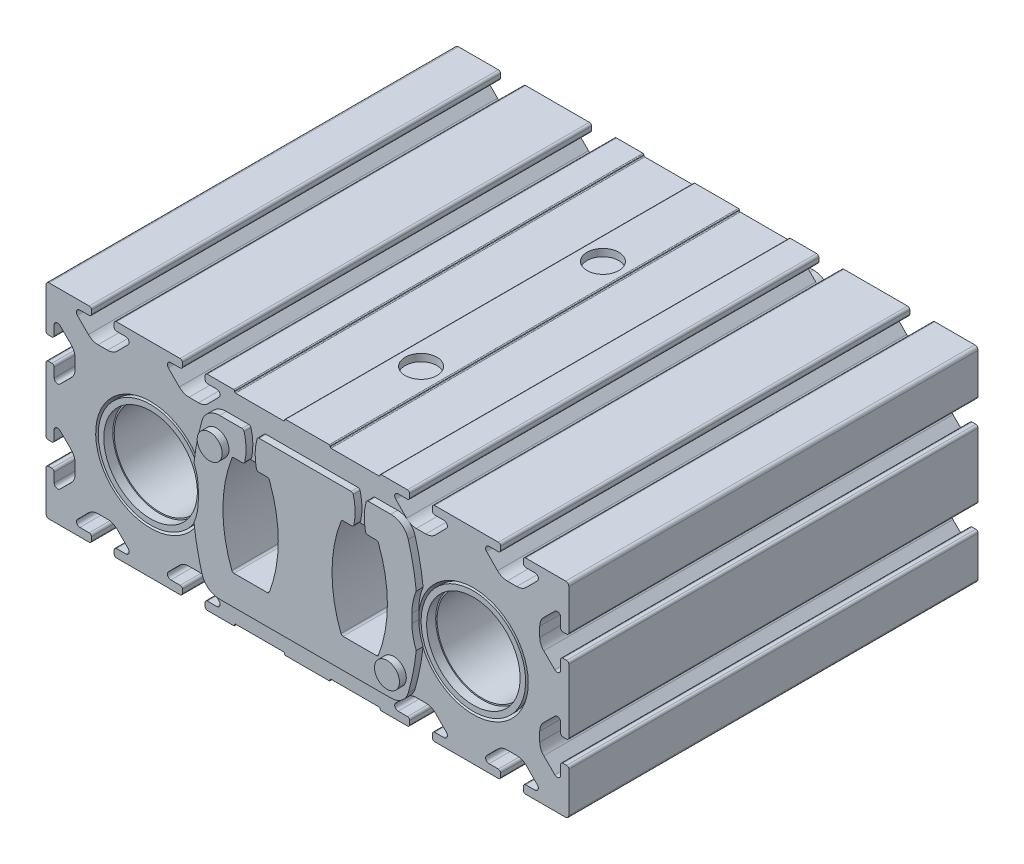
from build123d import *

# Parameters (mm, degrees)
BOSS_EXTRUDE1_DEPTH = 90
BOSS_EXTRUDE2_START = 1.5
SKETCH8_R           = 1.5
BOSS_EXTRUDE2_DEPTH = 1.5
SKETCH9_R           = 1.5
BOSS_EXTRUDE3_DEPTH = 1.5
SKETCH14_W          = 3.5
SKETCH14_H          = 1.6
SKETCH15_W          = 3.5
SKETCH15_H          = 1.6
SKETCH16_W          = 1.6
SKETCH16_H          = 3.5
SKETCH17_W          = 1.6
SKETCH17_H          = 3.5


with BuildPart() as part:
    # Sketch1 → Boss-Extrude1 (new body)
    with BuildSketch(Plane.XY):
        with BuildLine():
            Line((-56.8, -22.5), (-48, -22.5))
            ThreePointArc((-48, -22.5), (-47.646446609, -22.353553391), (-47.5, -22))
            Line((-47.5, -22), (-47.5, -21.2))
            ThreePointArc((-47.5, -21.2), (-47.646446609, -20.846446609), (-48, -20.7))
            Line((-48, -20.7), (-50.05, -20.7))
            ThreePointArc((-50.05, -20.7), (-50.742051615, -20.239075357), (-50.583480181, -19.422838832))
            Line((-50.583480181, -19.422838832), (-48.180797325, -16.991355328))
            ThreePointArc((-48.180797325, -16.991355328), (-47.203178031, -16.33179354), (-46.046876603, -16.1))
            Line((-46.046876603, -16.1), (-43.953123397, -16.1))
            ThreePointArc((-43.953123397, -16.1), (-42.796821969, -16.33179354), (-41.819202675, -16.991355328))
            Line((-41.819202675, -16.991355328), (-39.416519819, -19.422838832))
            ThreePointArc((-39.416519819, -19.422838832), (-39.257948385, -20.239075357), (-39.95, -20.7))
            Line((-39.95, -20.7), (-42, -20.7))
            ThreePointArc((-42, -20.7), (-42.353553391, -20.846446609), (-42.5, -21.2))
            Line((-42.5, -21.2), (-42.5, -22))
            ThreePointArc((-42.5, -22), (-42.353553391, -22.353553391), (-42, -22.5))
            Line((-42, -22.5), (-28, -22.5))
            ThreePointArc((-28, -22.5), (-27.646446609, -22.353553391), (-27.5, -22))
            Line((-27.5, -22), (-27.5, -21.2))
            ThreePointArc((-27.5, -21.2), (-27.646446609, -20.846446609), (-28, -20.7))
            Line((-28, -20.7), (-30.05, -20.7))
            ThreePointArc((-30.05, -20.7), (-30.742051615, -20.239075357), (-30.583480181, -19.422838832))
            Line((-30.583480181, -19.422838832), (-28.180797325, -16.991355328))
            ThreePointArc((-28.180797325, -16.991355328), (-27.203178031, -16.33179354), (-26.046876603, -16.1))
            Line((-26.046876603, -16.1), (-23.953123397, -16.1))
            ThreePointArc((-23.953123397, -16.1), (-22.796821969, -16.33179354), (-21.819202675, -16.991355328))
            Line((-21.819202675, -16.991355328), (-19.416519819, -19.422838832))
            ThreePointArc((-19.416519819, -19.422838832), (-19.257948385, -20.239075357), (-19.95, -20.7))
            Line((-19.95, -20.7), (-22, -20.7))
            ThreePointArc((-22, -20.7), (-22.353553391, -20.846446609), (-22.5, -21.2))
            Line((-22.5, -21.2), (-22.5, -22))
            ThreePointArc((-22.5, -22), (-22.353553391, -22.353553391), (-22, -22.5))
            Line((-22, -22.5), (-16.2, -22.5))
            ThreePointArc((-16.2, -22.5), (-16.058578644, -22.441421356), (-16, -22.3))
            Line((-16, -22.3), (-16, -22.2))
            ThreePointArc((-16, -22.2), (-15.941421356, -22.058578644), (-15.8, -22))
            Line((-15.8, -22), (-5.2, -22))
            ThreePointArc((-5.2, -22), (-5.058578644, -22.058578644), (-5, -22.2))
            Line((-5, -22.2), (-5, -22.3))
            ThreePointArc((-5, -22.3), (-4.941421356, -22.441421356), (-4.8, -22.5))
            Line((-4.8, -22.5), (4.8, -22.5))
            ThreePointArc((4.8, -22.5), (4.941421356, -22.441421356), (5, -22.3))
            Line((5, -22.3), (5, -22.2))
            ThreePointArc((5, -22.2), (5.058578644, -22.058578644), (5.2, -22))
            Line((5.2, -22), (15.8, -22))
            ThreePointArc((15.8, -22), (15.941421356, -22.058578644), (16, -22.2))
            Line((16, -22.2), (16, -22.3))
            ThreePointArc((16, -22.3), (16.058578644, -22.441421356), (16.2, -22.5))
            Line((16.2, -22.5), (22, -22.5))
            ThreePointArc((22, -22.5), (22.353553391, -22.353553391), (22.5, -22))
            Line((22.5, -22), (22.5, -21.2))
            ThreePointArc((22.5, -21.2), (22.353553391, -20.846446609), (22, -20.7))
            Line((22, -20.7), (19.95, -20.7))
            ThreePointArc((19.95, -20.7), (19.257948385, -20.239075357), (19.416519819, -19.422838832))
            Line((19.416519819, -19.422838832), (21.819202675, -16.991355328))
            ThreePointArc((21.819202675, -16.991355328), (22.796821969, -16.33179354), (23.953123397, -16.1))
            Line((23.953123397, -16.1), (26.046876603, -16.1))
            ThreePointArc((26.046876603, -16.1), (27.203178031, -16.33179354), (28.180797325, -16.991355328))
            Line((28.180797325, -16.991355328), (30.583480181, -19.422838832))
            ThreePointArc((30.583480181, -19.422838832), (30.742051615, -20.239075357), (30.05, -20.7))
            Line((30.05, -20.7), (28, -20.7))
            ThreePointArc((28, -20.7), (27.646446609, -20.846446609), (27.5, -21.2))
            Line((27.5, -21.2), (27.5, -22))
            ThreePointArc((27.5, -22), (27.646446609, -22.353553391), (28, -22.5))
            Line((28, -22.5), (42, -22.5))
            ThreePointArc((42, -22.5), (42.353553391, -22.353553391), (42.5, -22))
            Line((42.5, -22), (42.5, -21.2))
            ThreePointArc((42.5, -21.2), (42.353553391, -20.846446609), (42, -20.7))
            Line((42, -20.7), (39.95, -20.7))
            ThreePointArc((39.95, -20.7), (39.257948385, -20.239075357), (39.416519819, -19.422838832))
            Line((39.416519819, -19.422838832), (41.819202675, -16.991355328))
            ThreePointArc((41.819202675, -16.991355328), (42.796821969, -16.33179354), (43.953123397, -16.1))
            Line((43.953123397, -16.1), (46.046876603, -16.1))
            ThreePointArc((46.046876603, -16.1), (47.203178031, -16.33179354), (48.180797325, -16.991355328))
            Line((48.180797325, -16.991355328), (50.583480181, -19.422838832))
            ThreePointArc((50.583480181, -19.422838832), (50.742051615, -20.239075357), (50.05, -20.7))
            Line((50.05, -20.7), (48, -20.7))
            ThreePointArc((48, -20.7), (47.646446609, -20.846446609), (47.5, -21.2))
            Line((47.5, -21.2), (47.5, -22))
            ThreePointArc((47.5, -22), (47.646446609, -22.353553391), (48, -22.5))
            Line((48, -22.5), (56.8, -22.5))
            ThreePointArc((56.8, -22.5), (57.294974747, -22.294974747), (57.5, -21.8))
            Line((57.5, -21.8), (57.5, -13))
            ThreePointArc((57.5, -13), (57.353553391, -12.646446609), (57, -12.5))
            Line((57, -12.5), (56.2, -12.5))
            ThreePointArc((56.2, -12.5), (55.846446609, -12.646446609), (55.7, -13))
            Line((55.7, -13), (55.7, -15.05))
            ThreePointArc((55.7, -15.05), (55.239075357, -15.742051615), (54.422838832, -15.583480181))
            Line((54.422838832, -15.583480181), (51.991355328, -13.180797325))
            ThreePointArc((51.991355328, -13.180797325), (51.33179354, -12.203178031), (51.1, -11.046876603))
            Line((51.1, -11.046876603), (51.1, -8.953123397))
            ThreePointArc((51.1, -8.953123397), (51.33179354, -7.796821969), (51.991355328, -6.819202675))
            Line((51.991355328, -6.819202675), (54.422838832, -4.416519819))
            ThreePointArc((54.422838832, -4.416519819), (55.239075357, -4.257948385), (55.7, -4.95))
            Line((55.7, -4.95), (55.7, -7))
            ThreePointArc((55.7, -7), (55.846446609, -7.353553391), (56.2, -7.5))
            Line((56.2, -7.5), (57, -7.5))
            ThreePointArc((57, -7.5), (57.353553391, -7.353553391), (57.5, -7))
            Line((57.5, -7), (57.5, 7))
            ThreePointArc((57.5, 7), (57.353553391, 7.353553391), (57, 7.5))
            Line((57, 7.5), (56.2, 7.5))
            ThreePointArc((56.2, 7.5), (55.846446609, 7.353553391), (55.7, 7))
            Line((55.7, 7), (55.7, 4.95))
            ThreePointArc((55.7, 4.95), (55.239075357, 4.257948385), (54.422838832, 4.416519819))
            Line((54.422838832, 4.416519819), (51.991355328, 6.819202675))
            ThreePointArc((51.991355328, 6.819202675), (51.33179354, 7.796821969), (51.1, 8.953123397))
            Line((51.1, 8.953123397), (51.1, 11.046876603))
            ThreePointArc((51.1, 11.046876603), (51.33179354, 12.203178031), (51.991355328, 13.180797325))
            Line((51.991355328, 13.180797325), (54.422838832, 15.583480181))
            ThreePointArc((54.422838832, 15.583480181), (55.239075357, 15.742051615), (55.7, 15.05))
            Line((55.7, 15.05), (55.7, 13))
            ThreePointArc((55.7, 13), (55.846446609, 12.646446609), (56.2, 12.5))
            Line((56.2, 12.5), (57, 12.5))
            ThreePointArc((57, 12.5), (57.353553391, 12.646446609), (57.5, 13))
            Line((57.5, 13), (57.5, 21.8))
            ThreePointArc((57.5, 21.8), (57.294974747, 22.294974747), (56.8, 22.5))
            Line((56.8, 22.5), (48, 22.5))
            ThreePointArc((48, 22.5), (47.646446609, 22.353553391), (47.5, 22))
            Line((47.5, 22), (47.5, 21.2))
            ThreePointArc((47.5, 21.2), (47.646446609, 20.846446609), (48, 20.7))
            Line((48, 20.7), (50.05, 20.7))
            ThreePointArc((50.05, 20.7), (50.742051615, 20.239075357), (50.583480181, 19.422838832))
            Line((50.583480181, 19.422838832), (48.180797325, 16.991355328))
            ThreePointArc((48.180797325, 16.991355328), (47.203178031, 16.33179354), (46.046876603, 16.1))
            Line((46.046876603, 16.1), (43.953123397, 16.1))
            ThreePointArc((43.953123397, 16.1), (42.796821969, 16.33179354), (41.819202675, 16.991355328))
            Line((41.819202675, 16.991355328), (39.416519819, 19.422838832))
            ThreePointArc((39.416519819, 19.422838832), (39.257948385, 20.239075357), (39.95, 20.7))
            Line((39.95, 20.7), (42, 20.7))
            ThreePointArc((42, 20.7), (42.353553391, 20.846446609), (42.5, 21.2))
            Line((42.5, 21.2), (42.5, 22))
            ThreePointArc((42.5, 22), (42.353553391, 22.353553391), (42, 22.5))
            Line((42, 22.5), (28, 22.5))
            ThreePointArc((28, 22.5), (27.646446609, 22.353553391), (27.5, 22))
            Line((27.5, 22), (27.5, 21.2))
            ThreePointArc((27.5, 21.2), (27.646446609, 20.846446609), (28, 20.7))
            Line((28, 20.7), (30.05, 20.7))
            ThreePointArc((30.05, 20.7), (30.742051615, 20.239075357), (30.583480181, 19.422838832))
            Line((30.583480181, 19.422838832), (28.180797325, 16.991355328))
            ThreePointArc((28.180797325, 16.991355328), (27.203178031, 16.33179354), (26.046876603, 16.1))
            Line((26.046876603, 16.1), (23.953123397, 16.1))
            ThreePointArc((23.953123397, 16.1), (22.796821969, 16.33179354), (21.819202675, 16.991355328))
            Line((21.819202675, 16.991355328), (19.416519819, 19.422838832))
            ThreePointArc((19.416519819, 19.422838832), (19.257948385, 20.239075357), (19.95, 20.7))
            Line((19.95, 20.7), (22, 20.7))
            ThreePointArc((22, 20.7), (22.353553391, 20.846446609), (22.5, 21.2))
            Line((22.5, 21.2), (22.5, 22))
            ThreePointArc((22.5, 22), (22.353553391, 22.353553391), (22, 22.5))
            Line((22, 22.5), (16.2, 22.5))
            ThreePointArc((16.2, 22.5), (16.058578644, 22.441421356), (16, 22.3))
            Line((16, 22.3), (16, 22.2))
            ThreePointArc((16, 22.2), (15.941421356, 22.058578644), (15.8, 22))
            Line((15.8, 22), (5.2, 22))
            ThreePointArc((5.2, 22), (5.058578644, 22.058578644), (5, 22.2))
            Line((5, 22.2), (5, 22.3))
            ThreePointArc((5, 22.3), (4.941421356, 22.441421356), (4.8, 22.5))
            Line((4.8, 22.5), (-4.8, 22.5))
            ThreePointArc((-4.8, 22.5), (-4.941421356, 22.441421356), (-5, 22.3))
            Line((-5, 22.3), (-5, 22.2))
            ThreePointArc((-5, 22.2), (-5.058578644, 22.058578644), (-5.2, 22))
            Line((-5.2, 22), (-15.8, 22))
            ThreePointArc((-15.8, 22), (-15.941421356, 22.058578644), (-16, 22.2))
            Line((-16, 22.2), (-16, 22.3))
            ThreePointArc((-16, 22.3), (-16.058578644, 22.441421356), (-16.2, 22.5))
            Line((-16.2, 22.5), (-22, 22.5))
            ThreePointArc((-22, 22.5), (-22.353553391, 22.353553391), (-22.5, 22))
            Line((-22.5, 22), (-22.5, 21.2))
            ThreePointArc((-22.5, 21.2), (-22.353553391, 20.846446609), (-22, 20.7))
            Line((-22, 20.7), (-19.95, 20.7))
            ThreePointArc((-19.95, 20.7), (-19.257948385, 20.239075357), (-19.416519819, 19.422838832))
            Line((-19.416519819, 19.422838832), (-21.819202675, 16.991355328))
            ThreePointArc((-21.819202675, 16.991355328), (-22.796821969, 16.33179354), (-23.953123397, 16.1))
            Line((-23.953123397, 16.1), (-26.046876603, 16.1))
            ThreePointArc((-26.046876603, 16.1), (-27.203178031, 16.33179354), (-28.180797325, 16.991355328))
            Line((-28.180797325, 16.991355328), (-30.583480181, 19.422838832))
            ThreePointArc((-30.583480181, 19.422838832), (-30.742051615, 20.239075357), (-30.05, 20.7))
            Line((-30.05, 20.7), (-28, 20.7))
            ThreePointArc((-28, 20.7), (-27.646446609, 20.846446609), (-27.5, 21.2))
            Line((-27.5, 21.2), (-27.5, 22))
            ThreePointArc((-27.5, 22), (-27.646446609, 22.353553391), (-28, 22.5))
            Line((-28, 22.5), (-42, 22.5))
            ThreePointArc((-42, 22.5), (-42.353553391, 22.353553391), (-42.5, 22))
            Line((-42.5, 22), (-42.5, 21.2))
            ThreePointArc((-42.5, 21.2), (-42.353553391, 20.846446609), (-42, 20.7))
            Line((-42, 20.7), (-39.95, 20.7))
            ThreePointArc((-39.95, 20.7), (-39.257948385, 20.239075357), (-39.416519819, 19.422838832))
            Line((-39.416519819, 19.422838832), (-41.819202675, 16.991355328))
            ThreePointArc((-41.819202675, 16.991355328), (-42.796821969, 16.33179354), (-43.953123397, 16.1))
            Line((-43.953123397, 16.1), (-46.046876603, 16.1))
            ThreePointArc((-46.046876603, 16.1), (-47.203178031, 16.33179354), (-48.180797325, 16.991355328))
            Line((-48.180797325, 16.991355328), (-50.583480181, 19.422838832))
            ThreePointArc((-50.583480181, 19.422838832), (-50.742051615, 20.239075357), (-50.05, 20.7))
            Line((-50.05, 20.7), (-48, 20.7))
            ThreePointArc((-48, 20.7), (-47.646446609, 20.846446609), (-47.5, 21.2))
            Line((-47.5, 21.2), (-47.5, 22))
            ThreePointArc((-47.5, 22), (-47.646446609, 22.353553391), (-48, 22.5))
            Line((-48, 22.5), (-56.8, 22.5))
            ThreePointArc((-56.8, 22.5), (-57.294974747, 22.294974747), (-57.5, 21.8))
            Line((-57.5, 21.8), (-57.5, 13))
            ThreePointArc((-57.5, 13), (-57.353553391, 12.646446609), (-57, 12.5))
            Line((-57, 12.5), (-56.2, 12.5))
            ThreePointArc((-56.2, 12.5), (-55.846446609, 12.646446609), (-55.7, 13))
            Line((-55.7, 13), (-55.7, 15.05))
            ThreePointArc((-55.7, 15.05), (-55.239075357, 15.742051615), (-54.422838832, 15.583480181))
            Line((-54.422838832, 15.583480181), (-51.991355328, 13.180797325))
            ThreePointArc((-51.991355328, 13.180797325), (-51.33179354, 12.203178031), (-51.1, 11.046876603))
            Line((-51.1, 11.046876603), (-51.1, 8.953123397))
            ThreePointArc((-51.1, 8.953123397), (-51.33179354, 7.796821969), (-51.991355328, 6.819202675))
            Line((-51.991355328, 6.819202675), (-54.422838832, 4.416519819))
            ThreePointArc((-54.422838832, 4.416519819), (-55.239075357, 4.257948385), (-55.7, 4.95))
            Line((-55.7, 4.95), (-55.7, 7))
            ThreePointArc((-55.7, 7), (-55.846446609, 7.353553391), (-56.2, 7.5))
            Line((-56.2, 7.5), (-57, 7.5))
            ThreePointArc((-57, 7.5), (-57.353553391, 7.353553391), (-57.5, 7))
            Line((-57.5, 7), (-57.5, -7))
            ThreePointArc((-57.5, -7), (-57.353553391, -7.353553391), (-57, -7.5))
            Line((-57, -7.5), (-56.2, -7.5))
            ThreePointArc((-56.2, -7.5), (-55.846446609, -7.353553391), (-55.7, -7))
            Line((-55.7, -7), (-55.7, -4.95))
            ThreePointArc((-55.7, -4.95), (-55.239075357, -4.257948385), (-54.422838832, -4.416519819))
            Line((-54.422838832, -4.416519819), (-51.991355328, -6.819202675))
            ThreePointArc((-51.991355328, -6.819202675), (-51.33179354, -7.796821969), (-51.1, -8.953123397))
            Line((-51.1, -8.953123397), (-51.1, -11.046876603))
            ThreePointArc((-51.1, -11.046876603), (-51.33179354, -12.203178031), (-51.991355328, -13.180797325))
            Line((-51.991355328, -13.180797325), (-54.422838832, -15.583480181))
            ThreePointArc((-54.422838832, -15.583480181), (-55.239075357, -15.742051615), (-55.7, -15.05))
            Line((-55.7, -15.05), (-55.7, -13))
            ThreePointArc((-55.7, -13), (-55.846446609, -12.646446609), (-56.2, -12.5))
            Line((-56.2, -12.5), (-57, -12.5))
            ThreePointArc((-57, -12.5), (-57.353553391, -12.646446609), (-57.5, -13))
            Line((-57.5, -13), (-57.5, -21.8))
            ThreePointArc((-57.5, -21.8), (-57.294974747, -22.294974747), (-56.8, -22.5))
        make_face()
        with BuildLine():
            Line((9.34247397, -11), (16.65752603, -11))
            ThreePointArc((16.65752603, -11), (16.941266184, -10.911693485), (17.12478192, -10.677966102))
            ThreePointArc((17.12478192, -10.677966102), (19.089428526, 0), (17.12478192, 10.677966102))
            ThreePointArc((17.12478192, 10.677966102), (16.941266184, 10.911693485), (16.65752603, 11))
            Line((16.65752603, 11), (9.34247397, 11))
            ThreePointArc((9.34247397, 11), (9.058733816, 10.911693485), (8.87521808, 10.677966102))
            ThreePointArc((8.87521808, 10.677966102), (6.910571474, 0), (8.87521808, -10.677966102))
            ThreePointArc((8.87521808, -10.677966102), (9.058733816, -10.911693485), (9.34247397, -11))
        make_face(mode=Mode.SUBTRACT)
        with BuildLine():
            Line((-14.65752603, -11), (-7.34247397, -11))
            ThreePointArc((-7.34247397, -11), (-7.058733816, -10.911693485), (-6.87521808, -10.677966102))
            ThreePointArc((-6.87521808, -10.677966102), (-4.910571474, 0), (-6.87521808, 10.677966102))
            ThreePointArc((-6.87521808, 10.677966102), (-7.058733816, 10.911693485), (-7.34247397, 11))
            Line((-7.34247397, 11), (-14.65752603, 11))
            ThreePointArc((-14.65752603, 11), (-14.941266184, 10.911693485), (-15.12478192, 10.677966102))
            ThreePointArc((-15.12478192, 10.677966102), (-17.089428526, 0), (-15.12478192, -10.677966102))
            ThreePointArc((-15.12478192, -10.677966102), (-14.941266184, -10.911693485), (-14.65752603, -11))
        make_face(mode=Mode.SUBTRACT)
    extrude(amount=-BOSS_EXTRUDE1_DEPTH)

    # Sketch2 → Cut-Revolve1 (revolve, cut)
    with BuildSketch(Plane(origin=(0, -1, 0), x_dir=(1, 0, 0), z_dir=(0, 1, 0))):
        Polygon((-34.5, 90), (-22.422649731, 90), (-23, 89), (-23, 1), (-22.422649731, 0), (-34.5, 0), align=None)
    revolve(axis=Axis((-34.5, -1, 0), (0, 0, -1)), mode=Mode.SUBTRACT)

    # Sketch3 → Cut-Revolve2 (revolve, cut)
    with BuildSketch(Plane(origin=(0, -1, 0), x_dir=(1, 0, 0), z_dir=(0, 1, 0))):
        Polygon((36.5, 90), (48.577350269, 90), (48, 89), (48, 1), (48.577350269, 0), (36.5, 0), align=None)
    revolve(axis=Axis((36.5, -1, 0), (0, 0, -1)), mode=Mode.SUBTRACT)

    # Sketch4 → Revolve1 (revolve)
    with BuildSketch(Plane(origin=(0, -1, 0), x_dir=(1, 0, 0), z_dir=(0, 1, 0))):
        Polygon((-24.5, 2), (-24.21, 2), (-24.21, 0), (-23, 0), (-23, 24.2), (-23.461880215, 25), (-24.5, 25), align=None)
    revolve(axis=Axis((-34.5, -1, 0), (0, 0, -1)))

    # Sketch5 → Revolve2 (revolve)
    with BuildSketch(Plane(origin=(0, -1, 0), x_dir=(1, 0, 0), z_dir=(0, 1, 0))):
        Polygon((46.5, 2), (46.79, 2), (46.79, 0), (48, 0), (48, 24.2), (47.538119785, 25), (46.5, 25), align=None)
    revolve(axis=Axis((36.5, -1, 0), (0, 0, -1)))

    # Sketch6 → Revolve3 (revolve)
    with BuildSketch(Plane(origin=(0, -1, 0), x_dir=(1, 0, 0), z_dir=(0, 1, 0))):
        Polygon((46.5, 88), (46.5, 65), (47.538119785, 65), (48, 65.8), (48, 90), (46.79, 90), (46.79, 88), align=None)
    revolve(axis=Axis((36.5, -1, -65), (0, 0, -1)))

    # Sketch7 → Revolve4 (revolve)
    with BuildSketch(Plane(origin=(0, -1, 0), x_dir=(1, 0, 0), z_dir=(0, 1, 0))):
        Polygon((-24.5, 88), (-24.5, 65), (-23.461880215, 65), (-23, 65.8), (-23, 90), (-24.21, 90), (-24.21, 88), align=None)
    revolve(axis=Axis((-34.5, -1, -65), (0, 0, -1)))

    # Sketch8 → Boss-Extrude2 (add)
    with BuildSketch(Plane.XY.offset(BOSS_EXTRUDE2_START)):
        with BuildLine():
            Line((-22.5, 1), (-22.5, -1))
            ThreePointArc((-22.5, -1), (-22.738252666, -3.379348578), (-23.443549943, -5.664216132))
            ThreePointArc((-23.443549943, -5.664216132), (-22.754104345, -10.177290188), (-21.675177047, -14.613402062))
            ThreePointArc((-21.675177047, -14.613402062), (-20.236006364, -16.69793748), (-17.833258795, -17.5))
            Line((-17.833258795, -17.5), (19.833258795, -17.5))
            ThreePointArc((19.833258795, -17.5), (22.236006364, -16.69793748), (23.675177047, -14.613402062))
            ThreePointArc((23.675177047, -14.613402062), (24.754104345, -10.177290188), (25.443549943, -5.664216132))
            ThreePointArc((25.443549943, -5.664216132), (24.738252666, -3.379348578), (24.5, -1))
            Line((24.5, -1), (24.5, 1))
            ThreePointArc((24.5, 1), (24.738252666, 3.379348578), (25.443549943, 5.664216132))
            ThreePointArc((25.443549943, 5.664216132), (24.754104345, 10.177290189), (23.675177047, 14.613402062))
            ThreePointArc((23.675177047, 14.613402062), (22.236006364, 16.69793748), (19.833258795, 17.5))
            Line((19.833258795, 17.5), (14.898198344, 17.5))
            ThreePointArc((14.898198344, 17.5), (14.594238965, 17.396999617), (14.415511316, 17.130434783))
            ThreePointArc((14.415511316, 17.130434783), (14.003007987, 14.268668284), (14.286985572, 11.391304348))
            ThreePointArc((14.286985572, 11.391304348), (14.462256219, 11.109905251), (14.77502784, 11))
            Line((14.77502784, 11), (16.65752603, 11))
            ThreePointArc((16.65752603, 11), (16.941266184, 10.911693485), (17.12478192, 10.677966102))
            ThreePointArc((17.12478192, 10.677966102), (19.089428526, 0), (17.12478192, -10.677966102))
            ThreePointArc((17.12478192, -10.677966102), (16.941266184, -10.911693485), (16.65752603, -11))
            Line((16.65752603, -11), (9.34247397, -11))
            ThreePointArc((9.34247397, -11), (9.058733816, -10.911693485), (8.87521808, -10.677966102))
            ThreePointArc((8.87521808, -10.677966102), (6.910571474, 0), (8.87521808, 10.677966102))
            ThreePointArc((8.87521808, 10.677966102), (9.058733816, 10.911693485), (9.34247397, 11))
            Line((9.34247397, 11), (11.22497216, 11))
            ThreePointArc((11.22497216, 11), (11.537743781, 11.109905251), (11.713014428, 11.391304348))
            ThreePointArc((11.713014428, 11.391304348), (11.996992013, 14.268668284), (11.584488684, 17.130434783))
            ThreePointArc((11.584488684, 17.130434783), (11.405761035, 17.396999617), (11.101801656, 17.5))
            Line((11.101801656, 17.5), (-9.101801656, 17.5))
            ThreePointArc((-9.101801656, 17.5), (-9.405761035, 17.396999617), (-9.584488684, 17.130434783))
            ThreePointArc((-9.584488684, 17.130434783), (-9.996992013, 14.268668284), (-9.713014428, 11.391304348))
            ThreePointArc((-9.713014428, 11.391304348), (-9.537743781, 11.109905251), (-9.22497216, 11))
            Line((-9.22497216, 11), (-7.34247397, 11))
            ThreePointArc((-7.34247397, 11), (-7.058733816, 10.911693485), (-6.87521808, 10.677966102))
            ThreePointArc((-6.87521808, 10.677966102), (-4.910571474, 0), (-6.87521808, -10.677966102))
            ThreePointArc((-6.87521808, -10.677966102), (-7.058733816, -10.911693485), (-7.34247397, -11))
            Line((-7.34247397, -11), (-14.65752603, -11))
            ThreePointArc((-14.65752603, -11), (-14.941266184, -10.911693485), (-15.12478192, -10.677966102))
            ThreePointArc((-15.12478192, -10.677966102), (-17.089428526, 0), (-15.12478192, 10.677966102))
            ThreePointArc((-15.12478192, 10.677966102), (-14.941266184, 10.911693485), (-14.65752603, 11))
            Line((-14.65752603, 11), (-12.77502784, 11))
            ThreePointArc((-12.77502784, 11), (-12.462256219, 11.109905251), (-12.286985572, 11.391304348))
            ThreePointArc((-12.286985572, 11.391304348), (-12.003007987, 14.268668284), (-12.415511316, 17.130434783))
            ThreePointArc((-12.415511316, 17.130434783), (-12.594238965, 17.396999617), (-12.898198344, 17.5))
            Line((-12.898198344, 17.5), (-17.833258795, 17.5))
            ThreePointArc((-17.833258795, 17.5), (-20.236006364, 16.69793748), (-21.675177047, 14.613402062))
            ThreePointArc((-21.675177047, 14.613402062), (-22.754104345, 10.177290188), (-23.443549943, 5.664216132))
            ThreePointArc((-23.443549943, 5.664216132), (-22.738252666, 3.379348578), (-22.5, 1))
        make_face()
        with Locations((20.5, -12)):
            Circle(SKETCH8_R, mode=Mode.SUBTRACT)
        with Locations((-18.5, 12)):
            Circle(SKETCH8_R, mode=Mode.SUBTRACT)
    extrude(amount=-BOSS_EXTRUDE2_DEPTH)

    # Sketch9 → Boss-Extrude3 (add)
    with BuildSketch(Plane.XY.offset(-90)):
        with BuildLine():
            Line((-22.5, 1), (-22.5, -1))
            ThreePointArc((-22.5, -1), (-22.738252666, -3.379348578), (-23.443549943, -5.664216132))
            ThreePointArc((-23.443549943, -5.664216132), (-22.754104345, -10.177290188), (-21.675177047, -14.613402062))
            ThreePointArc((-21.675177047, -14.613402062), (-20.236006364, -16.69793748), (-17.833258795, -17.5))
            Line((-17.833258795, -17.5), (19.833258795, -17.5))
            ThreePointArc((19.833258795, -17.5), (22.236006364, -16.69793748), (23.675177047, -14.613402062))
            ThreePointArc((23.675177047, -14.613402062), (24.754104345, -10.177290188), (25.443549943, -5.664216132))
            ThreePointArc((25.443549943, -5.664216132), (24.738252666, -3.379348578), (24.5, -1))
            Line((24.5, -1), (24.5, 1))
            ThreePointArc((24.5, 1), (24.738252666, 3.379348578), (25.443549943, 5.664216132))
            ThreePointArc((25.443549943, 5.664216132), (24.754104345, 10.177290189), (23.675177047, 14.613402062))
            ThreePointArc((23.675177047, 14.613402062), (22.236006364, 16.69793748), (19.833258795, 17.5))
            Line((19.833258795, 17.5), (14.898198344, 17.5))
            ThreePointArc((14.898198344, 17.5), (14.594238965, 17.396999617), (14.415511316, 17.130434783))
            ThreePointArc((14.415511316, 17.130434783), (14.003007987, 14.268668284), (14.286985572, 11.391304348))
            ThreePointArc((14.286985572, 11.391304348), (14.462256219, 11.109905251), (14.77502784, 11))
            Line((14.77502784, 11), (16.65752603, 11))
            ThreePointArc((16.65752603, 11), (16.941266184, 10.911693485), (17.12478192, 10.677966102))
            ThreePointArc((17.12478192, 10.677966102), (19.089428526, 0), (17.12478192, -10.677966102))
            ThreePointArc((17.12478192, -10.677966102), (16.941266184, -10.911693485), (16.65752603, -11))
            Line((16.65752603, -11), (9.34247397, -11))
            ThreePointArc((9.34247397, -11), (9.058733816, -10.911693485), (8.87521808, -10.677966102))
            ThreePointArc((8.87521808, -10.677966102), (6.910571474, 0), (8.87521808, 10.677966102))
            ThreePointArc((8.87521808, 10.677966102), (9.058733816, 10.911693485), (9.34247397, 11))
            Line((9.34247397, 11), (11.22497216, 11))
            ThreePointArc((11.22497216, 11), (11.537743781, 11.109905251), (11.713014428, 11.391304348))
            ThreePointArc((11.713014428, 11.391304348), (11.996992013, 14.268668284), (11.584488684, 17.130434783))
            ThreePointArc((11.584488684, 17.130434783), (11.405761035, 17.396999617), (11.101801656, 17.5))
            Line((11.101801656, 17.5), (-9.101801656, 17.5))
            ThreePointArc((-9.101801656, 17.5), (-9.405761035, 17.396999617), (-9.584488684, 17.130434783))
            ThreePointArc((-9.584488684, 17.130434783), (-9.996992013, 14.268668284), (-9.713014428, 11.391304348))
            ThreePointArc((-9.713014428, 11.391304348), (-9.537743781, 11.109905251), (-9.22497216, 11))
            Line((-9.22497216, 11), (-7.34247397, 11))
            ThreePointArc((-7.34247397, 11), (-7.058733816, 10.911693485), (-6.87521808, 10.677966102))
            ThreePointArc((-6.87521808, 10.677966102), (-4.910571474, 0), (-6.87521808, -10.677966102))
            ThreePointArc((-6.87521808, -10.677966102), (-7.058733816, -10.911693485), (-7.34247397, -11))
            Line((-7.34247397, -11), (-14.65752603, -11))
            ThreePointArc((-14.65752603, -11), (-14.941266184, -10.911693485), (-15.12478192, -10.677966102))
            ThreePointArc((-15.12478192, -10.677966102), (-17.089428526, 0), (-15.12478192, 10.677966102))
            ThreePointArc((-15.12478192, 10.677966102), (-14.941266184, 10.911693485), (-14.65752603, 11))
            Line((-14.65752603, 11), (-12.77502784, 11))
            ThreePointArc((-12.77502784, 11), (-12.462256219, 11.109905251), (-12.286985572, 11.391304348))
            ThreePointArc((-12.286985572, 11.391304348), (-12.003007987, 14.268668284), (-12.415511316, 17.130434783))
            ThreePointArc((-12.415511316, 17.130434783), (-12.594238965, 17.396999617), (-12.898198344, 17.5))
            Line((-12.898198344, 17.5), (-17.833258795, 17.5))
            ThreePointArc((-17.833258795, 17.5), (-20.236006364, 16.69793748), (-21.675177047, 14.613402062))
            ThreePointArc((-21.675177047, 14.613402062), (-22.754104345, 10.177290188), (-23.443549943, 5.664216132))
            ThreePointArc((-23.443549943, 5.664216132), (-22.738252666, 3.379348578), (-22.5, 1))
        make_face()
        with Locations((20.5, -12)):
            Circle(SKETCH9_R, mode=Mode.SUBTRACT)
        with Locations((-18.5, 12)):
            Circle(SKETCH9_R, mode=Mode.SUBTRACT)
    extrude(amount=-BOSS_EXTRUDE3_DEPTH)

    # Sketch10 → Revolve5 (revolve)
    with BuildSketch(Plane(origin=(-18.5, 0, 0), x_dir=(0, 0, -1), z_dir=(1, 0, 0))):
        Polygon((74.4, 12), (74.4, 12.5), (74.9, 13), (77, 13), (77, 13.1), (77.5, 13.6), (91.5, 13.6), (91.5, 14.75), (93, 14.75), (93, 12), align=None)
    revolve(axis=Axis((-18.5, 12, -93), (0, 0, 1)))

    # Sketch11 → Revolve6 (revolve)
    with BuildSketch(Plane(origin=(-18.5, 0, 0), x_dir=(0, 0, -1), z_dir=(1, 0, 0))):
        Polygon((-3, 12), (-3, 14.75), (-1.5, 14.75), (-1.5, 13.6), (12.5, 13.6), (13, 13.1), (13, 13), (15.1, 13), (15.6, 12.5), (15.6, 12), align=None)
    revolve(axis=Axis((-18.5, 12, -15.6), (0, 0, 1)))

    # Sketch12 → Revolve7 (revolve)
    with BuildSketch(Plane(origin=(20.5, 0, 0), x_dir=(0, 0, -1), z_dir=(1, 0, 0))):
        Polygon((-3, -12), (-3, -9.25), (-1.5, -9.25), (-1.5, -10.4), (12.5, -10.4), (13, -10.9), (13, -11), (15.1, -11), (15.6, -11.5), (15.6, -12), align=None)
    revolve(axis=Axis((20.5, -12, -15.6), (0, 0, 1)))

    # Sketch13 → Revolve8 (revolve)
    with BuildSketch(Plane(origin=(20.5, 0, 0), x_dir=(0, 0, -1), z_dir=(1, 0, 0))):
        Polygon((74.4, -12), (74.4, -11.5), (74.9, -11), (77, -11), (77, -10.9), (77.5, -10.4), (91.5, -10.4), (91.5, -9.25), (93, -9.25), (93, -12), align=None)
    revolve(axis=Axis((20.5, -12, -93), (0, 0, 1)))

    # Sketch14 → Cut-Revolve3 (revolve, cut)
    with BuildSketch(Plane(origin=(0, 0, 0), x_dir=(0, 0, -1), z_dir=(1, 0, 0))):
        with Locations((26.75, 21.7)):
            Rectangle(SKETCH14_W, SKETCH14_H)
    revolve(axis=Axis((0, 20.9, -25), (0, 1, 0)), mode=Mode.SUBTRACT)

    # Sketch15 → Cut-Revolve4 (revolve, cut)
    with BuildSketch(Plane(origin=(0, 0, 0), x_dir=(0, 0, -1), z_dir=(1, 0, 0))):
        with Locations((66.75, 21.7)):
            Rectangle(SKETCH15_W, SKETCH15_H)
    revolve(axis=Axis((0, 20.9, -65), (0, 1, 0)), mode=Mode.SUBTRACT)

    # Sketch16 → Cut-Revolve5 (revolve, cut)
    with BuildSketch(Plane(origin=(0, 0, 0), x_dir=(1, 0, 0), z_dir=(0, 1, 0))):
        with Locations((-56.7, 26.75)):
            Rectangle(SKETCH16_W, SKETCH16_H)
    revolve(axis=Axis((-55.9, 0, -25), (-1, 0, 0)), mode=Mode.SUBTRACT)

    # Sketch17 → Cut-Revolve6 (revolve, cut)
    with BuildSketch(Plane(origin=(0, 0, 0), x_dir=(1, 0, 0), z_dir=(0, 1, 0))):
        with Locations((-56.7, 66.75)):
            Rectangle(SKETCH17_W, SKETCH17_H)
    revolve(axis=Axis((-55.9, 0, -65), (-1, 0, 0)), mode=Mode.SUBTRACT)


solid = part.part
